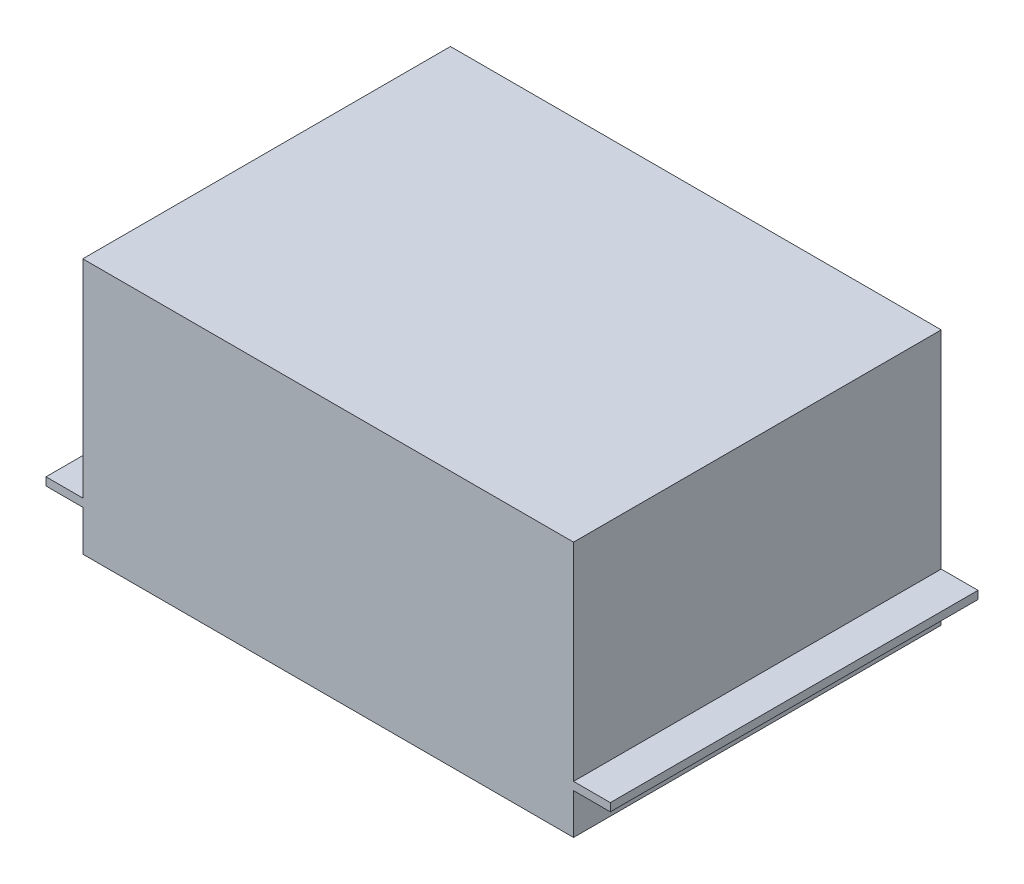
from build123d import *

# Parameters (mm, degrees)
SKETCH1_W           = 307
SKETCH1_H           = 230
BOSS_EXTRUDE1_DEPTH = 160
BOSS_EXTRUDE2_START = 25.4
SKETCH1_3_W         = 23
SKETCH1_3_H         = 230
BOSS_EXTRUDE2_DEPTH = 5


with BuildPart() as part:
    # Sketch1 → Boss-Extrude1 (new body)
    with BuildSketch(Plane(origin=(0, 0, 0), x_dir=(1, 0, 0), z_dir=(0, 1, 0))):
        Rectangle(SKETCH1_W, SKETCH1_H)
    extrude(amount=BOSS_EXTRUDE1_DEPTH)

    # Sketch1<3> → Boss-Extrude2 (add)
    with BuildSketch(Plane(origin=(0, 0, 0), x_dir=(1, 0, 0), z_dir=(0, 1, 0)).offset(BOSS_EXTRUDE2_START)):
        with Locations((-165, 0)):
            Rectangle(SKETCH1_3_W, SKETCH1_3_H)
        with Locations((165, 0)):
            Rectangle(SKETCH1_3_W, SKETCH1_3_H)
    extrude(amount=BOSS_EXTRUDE2_DEPTH)


solid = part.part
